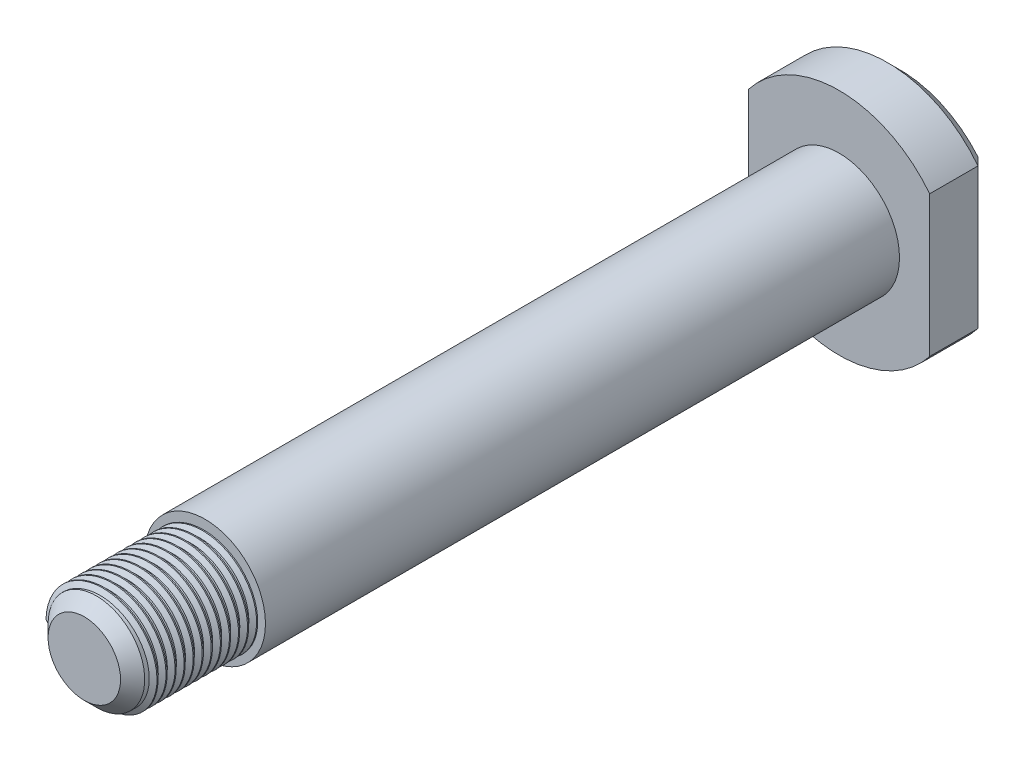
from build123d import *

# Parameters (mm, degrees)
BOSS_EXTRUDE1_DEPTH = 10
CHAMFER1_SIZE       = 2
SKETCH2_R           = 10
BOSS_EXTRUDE2_DEPTH = 105
SKETCH3_R           = 8
BOSS_EXTRUDE3_DEPTH = 20
CHAMFER2_SIZE       = 2
THREAD1_PITCH       = 1.5


with BuildPart() as part:
    # Sketch1 → Boss-Extrude1 (new body)
    with BuildSketch(Plane.XY):
        with BuildLine():
            Line((-15, 11.66190379), (-15, -11.66190379))
            ThreePointArc((-15, -11.66190379), (0, -19), (15, -11.66190379))
            Line((15, -11.66190379), (15, 11.66190379))
            ThreePointArc((15, 11.66190379), (0, 19), (-15, 11.66190379))
        make_face()
    extrude(amount=BOSS_EXTRUDE1_DEPTH)

    # Chamfer1
    chamfer1_edges = [part.edges().sort_by_distance(p)[0] for p in [
        (-15, 0, 0),
        (0, 19, 0),
        (15, 0, 0),
        (0, -19, 0),
    ]]
    chamfer(chamfer1_edges, length=CHAMFER1_SIZE)

    # Sketch2 → Boss-Extrude2 (add)
    with BuildSketch(Plane.XY.offset(10)):
        Circle(SKETCH2_R)
    extrude(amount=BOSS_EXTRUDE2_DEPTH)

    # Sketch3 → Boss-Extrude3 (add)
    with BuildSketch(Plane.XY.offset(115)):
        Circle(SKETCH3_R)
    extrude(amount=BOSS_EXTRUDE3_DEPTH)

    # Chamfer2
    chamfer2_edges = [part.edges().sort_by_distance(p)[0] for p in [
        (-8, 0, 135),
    ]]
    chamfer(chamfer2_edges, length=CHAMFER2_SIZE)

    # Thread1: the profile of Thread Profile1 profile screwed along a right-hand helix of 12 turns, 8 arcs to a turn; built about Z, then put on its axis
    thread1_z = Axis((0, 0, 0), (0, 0, 1))
    thread1_corners = [(7.9997, 0, -0.000173205), (8.811898813, 0, 0.468749998), (8.811898813, 0, 0.656249998), (7.9997, 0, 1.125173201)]
    with BuildLine(mode=Mode.PRIVATE) as thread1_profile:
        Line(thread1_corners[0], thread1_corners[1])
        Line(thread1_corners[1], thread1_corners[2])
        Line(thread1_corners[2], thread1_corners[3])
        Line(thread1_corners[3], thread1_corners[0])
    thread1_cap = Face(thread1_profile.wire())
    thread1_turn_angles = [0, 22.5, 45, 67.5, 90, 112.5, 135, 157.5, 180, 202.5, 225, 247.5, 270, 292.5, 315, 337.5, 360]
    thread1_turn_weights = [1, 0.9238795325112867, 1, 0.9238795325112867, 1, 0.9238795325112867, 1, 0.9238795325112867, 1, 0.9238795325112867, 1, 0.9238795325112867, 1, 0.9238795325112867, 1, 0.9238795325112867, 1]
    thread1_turn_rails = [Edge.make_bspline([Vector(p[0], p[1], 0).rotate(thread1_z, thread1_turn_angles[k]) / thread1_turn_weights[k] + Vector(0, 0, p[2] + THREAD1_PITCH * thread1_turn_angles[k] / 360) for k in range(17)], [0, 0, 0, 1, 1, 2, 2, 3, 3, 4, 4, 5, 5, 6, 6, 7, 7, 8, 8, 8], 2, thread1_turn_weights) for p in thread1_corners]
    thread1_turn_sides = [Face.make_surface_from_curves(thread1_turn_rails[p[0]], thread1_turn_rails[p[1]]) for p in [(0, 1), (1, 2), (2, 3), (3, 0)]]
    thread1 = Plane(origin=(0, 0, 133), x_dir=(-1, 0, 0), z_dir=(0, 0, -1)) * Solid(Shell([*[p.moved(Location((0, 0, THREAD1_PITCH * i))) for i in range(12) for p in thread1_turn_sides], thread1_cap, thread1_cap.rotate(thread1_z, 4320).moved(Location((0, 0, THREAD1_PITCH * 4320 / 360)))]))
    add(thread1)


solid = part.part
